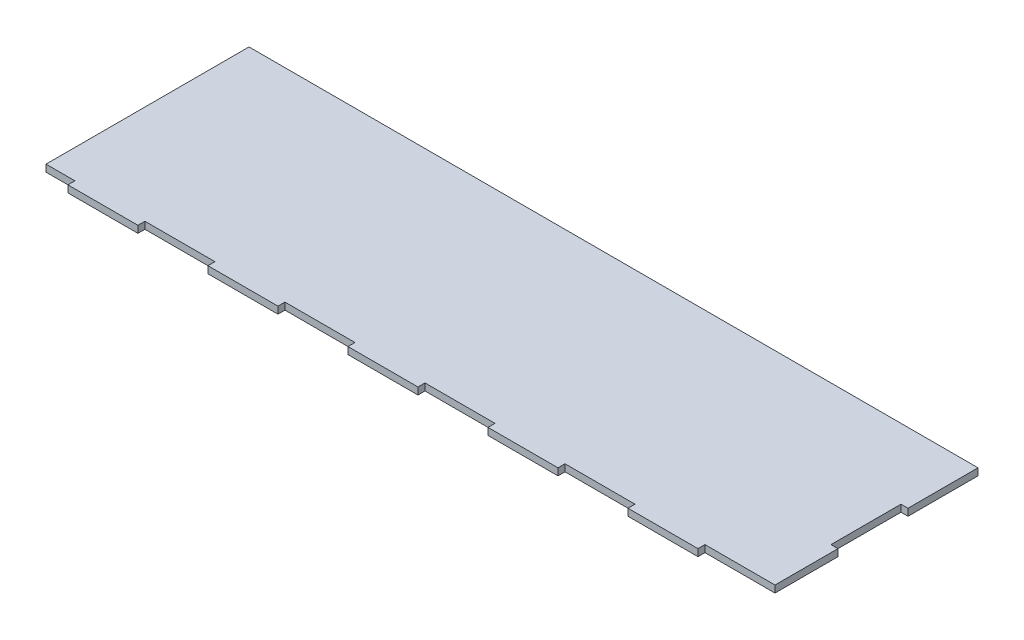
from build123d import *

# Parameters (mm, degrees)
SKETCH1_W              = 630
SKETCH1_H              = 90
BOSS_EXTRUDE1_DEPTH    = 3
SKETCH3_W              = 30
SKETCH3_H              = 3
CUT_EXTRUDE1_DEPTH     = 3
LPATTERN1_COUNT        = 10
LPATTERN1_PITCH        = 60
LPATTERN1_COL_COUNT    = 2
LPATTERN1_COL_PITCH    = 60
CUT_EXTRUDE5_START     = -3
CUT_EXTRUDE5_OUTLINE_W = 3
CUT_EXTRUDE5_OUTLINE_H = 30
CUT_EXTRUDE5_DEPTH     = 3
SKETCH7_W              = 3
SKETCH7_H              = 30
CUT_EXTRUDE3_DEPTH     = 3
SKETCH13_W             = 3
SKETCH13_H             = 27
CUT_EXTRUDE4_DEPTH     = 10


# Read off the part's stored shape, not the designer's step: Cut-Extrude5
with BuildPart() as part:
    # Sketch1 → Boss-Extrude1 (new body)
    with BuildSketch(Plane(origin=(0, 0, 0), x_dir=(1, 0, 0), z_dir=(0, 1, 0))):
        Rectangle(SKETCH1_W, SKETCH1_H)
    extrude(amount=BOSS_EXTRUDE1_DEPTH)

    # Sketch3 → Cut-Extrude1 (cut)
    with BuildSketch(Plane(origin=(0, 3, 0), x_dir=(1, 0, 0), z_dir=(0, 1, 0))):
        with Locations((-240, -43.5)):
            Rectangle(SKETCH3_W, SKETCH3_H)
    cut_extrude1 = extrude(amount=-CUT_EXTRUDE1_DEPTH, mode=Mode.SUBTRACT)

    # LPattern1: Cut-Extrude1 ×10
    with Locations(*[(i * LPATTERN1_PITCH, 0, 0) for i in range(1, LPATTERN1_COUNT)]):
        add(cut_extrude1, mode=Mode.SUBTRACT)

    # LPattern1 col: Cut-Extrude1 ×2
    with Locations(*[(-i * LPATTERN1_COL_PITCH, 0, 0) for i in range(1, LPATTERN1_COL_COUNT)]):
        add(cut_extrude1, mode=Mode.SUBTRACT)

    # Cut-Extrude5 outline → Cut-Extrude5 (cut)
    with BuildSketch(Plane(origin=(0, 3, 0), x_dir=(1, 0, 0), z_dir=(0, 1, 0)).offset(CUT_EXTRUDE5_START)):
        with Locations((313.5, 1e-09)):
            Rectangle(CUT_EXTRUDE5_OUTLINE_W, CUT_EXTRUDE5_OUTLINE_H)
    extrude(amount=CUT_EXTRUDE5_DEPTH, mode=Mode.SUBTRACT)

    # Sketch7 → Cut-Extrude3 (cut)
    with BuildSketch(Plane(origin=(0, 3, 0), x_dir=(1, 0, 0), z_dir=(0, 1, 0))):
        with Locations((-313.5, 30)):
            Rectangle(SKETCH7_W, SKETCH7_H)
    extrude(amount=-CUT_EXTRUDE3_DEPTH, mode=Mode.SUBTRACT)

    # Sketch13 → Cut-Extrude4 (cut)
    with BuildSketch(Plane(origin=(0, 3, 0), x_dir=(1, 0, 0), z_dir=(0, 1, 0))):
        with Locations((-313.5, -28.5)):
            Rectangle(SKETCH13_W, SKETCH13_H)
    extrude(amount=-CUT_EXTRUDE4_DEPTH, mode=Mode.SUBTRACT)

    # SurfaceCut1
    split(bisect_by=Plane.ZY.offset(-2.6), keep=Keep.BOTTOM)


solid = part.part
